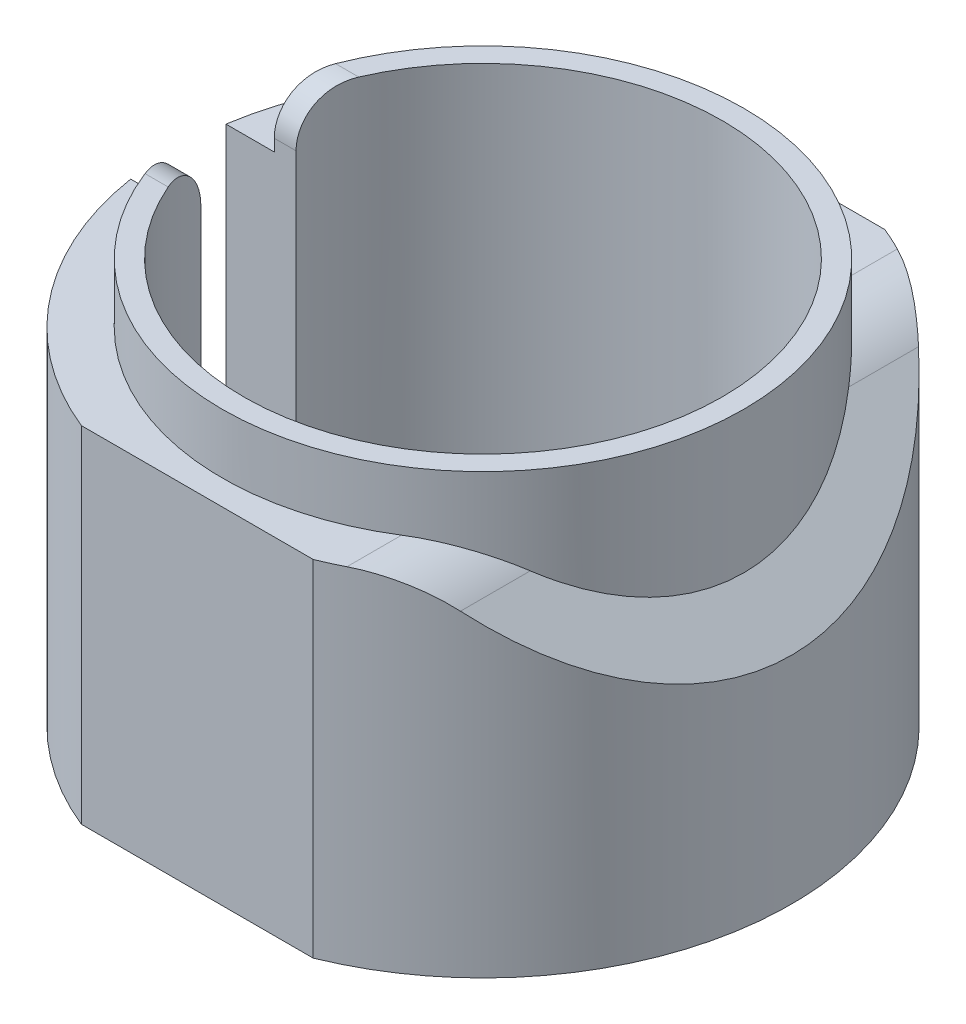
from build123d import *

# Parameters (mm, degrees)
SKETCH1_R               = 10.95
SKETCH1_R_2             = 10.05
BOSS_EXTRUDE1_DEPTH     = 2
BOSS_EXTRUDE2_START     = 15
SKETCH1_3_R             = 10.95
SKETCH1_3_R_2           = 10.05
BOSS_EXTRUDE2_DEPTH     = 15
BOSS_EXTRUDE3_START     = -2.5
SKETCH2_R               = 12.95
SKETCH2_R_2             = 10.95
BOSS_EXTRUDE3_DEPTH     = 14.5
CUT_EXTRUDE1_DEPTH      = 24.672874773
CUT_EXTRUDE1_DEPTH_BACK = 24.672874773
SKETCH3_W               = 100
SKETCH3_H               = 24
CUT_EXTRUDE3_DEPTH      = 24.166840527
CUT_EXTRUDE3_DEPTH_BACK = 24.166840527
BOSS_EXTRUDE4_START     = 15
SKETCH1_4_R             = 10.95
SKETCH1_4_R_2           = 10.05
BOSS_EXTRUDE4_DEPTH     = 15
SKETCH5_W               = 18
SKETCH5_H               = 4
CUT_EXTRUDE4_DEPTH      = 24.166840527
FILLET1_R               = 2
FILLET2_R               = 4
CUT_EXTRUDE5_DEPTH      = 24.166840699
CUT_EXTRUDE5_DEPTH_BACK = 24.166840699
SKETCH6_R               = 1.6


with BuildPart() as part:
    # Sketch1 → Boss-Extrude1 (new body)
    # profile 1 of 2: a face of its own
    with BuildSketch(Plane(origin=(0, 0, 0), x_dir=(1, 0, 0), z_dir=(0, 1, 0))):
        with Locations(Location((0, 0, 0), (0, 0, 270))):
            Circle(SKETCH1_R)
        Circle(SKETCH1_R_2, mode=Mode.SUBTRACT)
    # profile 2 of 2: a face of its own
    with BuildSketch(Plane(origin=(0, 0, 0), x_dir=(1, 0, 0), z_dir=(0, 1, 0))):
        Circle(SKETCH1_R_2)
    extrude(amount=-BOSS_EXTRUDE1_DEPTH)

    # Sketch1<3> → Boss-Extrude2 (add)
    with BuildSketch(Plane(origin=(0, 0, 0), x_dir=(1, 0, 0), z_dir=(0, 1, 0)).offset(BOSS_EXTRUDE2_START)):
        with Locations(Location((0, 0, 0), (0, 0, 270))):
            Circle(SKETCH1_3_R)
        with Locations(Location((0, 0, 0), (0, 0, 270))):
            Circle(SKETCH1_3_R_2, mode=Mode.SUBTRACT)
    extrude(amount=-BOSS_EXTRUDE2_DEPTH)

    # Sketch2 → Boss-Extrude3 (add)
    with BuildSketch(Plane(origin=(0, 15, 0), x_dir=(1, 0, 0), z_dir=(0, 1, 0)).offset(BOSS_EXTRUDE3_START)):
        with Locations(Location((0, 0, 0), (0, 0, 270))):
            Circle(SKETCH2_R)
        with Locations(Location((0, 0, 0), (0, 0, 270))):
            Circle(SKETCH2_R_2, mode=Mode.SUBTRACT)
    extrude(amount=-BOSS_EXTRUDE3_DEPTH)

    # Sketch3 → Cut-Extrude1 (cut, two sides: drawn at the far end of the back side and taken through both)
    with BuildSketch(Plane(origin=(0, 0, 0), x_dir=(1, 0, 0), z_dir=(0, 1, 0)).offset(-CUT_EXTRUDE1_DEPTH_BACK)):
        with Locations((0, -24)):
            Rectangle(SKETCH3_W, SKETCH3_H)
        with Locations((0, 24)):
            Rectangle(SKETCH3_W, SKETCH3_H)
    extrude(amount=CUT_EXTRUDE1_DEPTH + CUT_EXTRUDE1_DEPTH_BACK, mode=Mode.SUBTRACT)

    # Sketch4 → Cut-Extrude3 (cut, two sides: drawn at the far end of the back side and taken through both)
    with BuildSketch(Plane.XY.offset(-CUT_EXTRUDE3_DEPTH_BACK)):
        Polygon((13, 15), (5, 15), (13, 7), align=None)
    extrude(amount=CUT_EXTRUDE3_DEPTH + CUT_EXTRUDE3_DEPTH_BACK, mode=Mode.SUBTRACT)

    # Sketch1<4> → Boss-Extrude4 (add)
    with BuildSketch(Plane(origin=(0, 0, 0), x_dir=(1, 0, 0), z_dir=(0, 1, 0)).offset(BOSS_EXTRUDE4_START)):
        with Locations(Location((0, 0, 0), (0, 0, 270))):
            Circle(SKETCH1_4_R)
        with Locations(Location((0, 0, 0), (0, 0, 270))):
            Circle(SKETCH1_4_R_2, mode=Mode.SUBTRACT)
    extrude(amount=-BOSS_EXTRUDE4_DEPTH)

    # Sketch5 → Cut-Extrude4 (cut, through all)
    with BuildSketch(Plane(origin=(0, 0, 0), x_dir=(1, 0, 0), z_dir=(0, 1, 0))):
        with Locations((-11, 0)):
            Rectangle(SKETCH5_W, SKETCH5_H)
    extrude(amount=CUT_EXTRUDE4_DEPTH, mode=Mode.SUBTRACT)

    # Fillet1
    fillet1_edges = [part.edges().sort_by_distance(p)[0] for p in [
        (-10.307393529, 15, 2),
        (-10.307393529, 15, -2),
        (-11.321806249, 0, -2),
        (-11.321806249, 0, 2),
    ]]
    fillet(fillet1_edges, radius=FILLET1_R - 0.0001)  # a hair under: the kernel refuses the full size

    # Fillet2
    fillet2_edges = [part.edges().sort_by_distance(p)[0] for p in [
        (7.5, 12.5, 9.26767915),
        (7.5, 12.5, -9.26767915),
    ]]
    fillet(fillet2_edges, radius=FILLET2_R)

    # Sketch6 → Cut-Extrude5 (cut, two sides: drawn at the far end of the back side and taken through both)
    with BuildSketch(Plane(origin=(0, 0, 0), x_dir=(1, 0, 0), z_dir=(0, 1, 0)).offset(-CUT_EXTRUDE5_DEPTH_BACK)):
        with Locations(Location((0, 0, 0), (0, 0, 270))):
            Circle(SKETCH6_R)
    extrude(amount=CUT_EXTRUDE5_DEPTH + CUT_EXTRUDE5_DEPTH_BACK, mode=Mode.SUBTRACT)


solid = part.part
